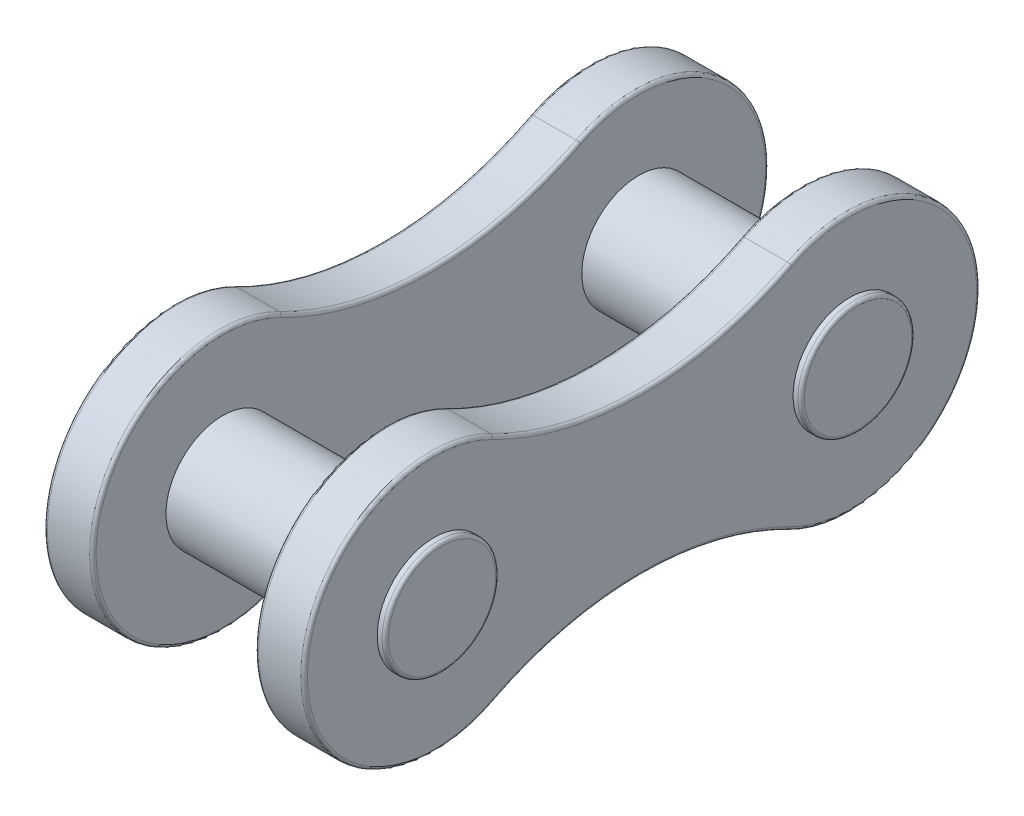
from build123d import *

# Parameters (mm, degrees)
BOSS_EXTRUDE2_START = 2.5
SKETCH5_R           = 1.75
BOSS_EXTRUDE2_DEPTH = 1.5
BOSS_EXTRUDE3_START = -2.5
SKETCH6_R           = 1.75
BOSS_EXTRUDE3_DEPTH = 1.5
SKETCH7_R           = 1.75
BOSS_EXTRUDE4_DEPTH = 4.25
FILLET1_R           = 0.1


with BuildPart() as part:
    # Sketch5 → Boss-Extrude2 (new body)
    with BuildSketch(Plane(origin=(0, 0, 0), x_dir=(0, 0, -1), z_dir=(1, 0, 0)).offset(BOSS_EXTRUDE2_START)):
        with BuildLine():
            ThreePointArc((-4.570357143, 3.557793374), (-10.3985, 0), (-4.570357143, -3.557793374))
            ThreePointArc((-4.570357143, -3.557793374), (0, -2.45227681), (4.570357143, -3.557793374))
            ThreePointArc((4.570357143, -3.557793374), (10.3985, 0), (4.570357143, 3.557793374))
            ThreePointArc((4.570357143, 3.557793374), (0, 2.45227681), (-4.570357143, 3.557793374))
        make_face()
        with Locations((-6.3985, 0)):
            Circle(SKETCH5_R, mode=Mode.SUBTRACT)
        with Locations((6.3985, 0)):
            Circle(SKETCH5_R, mode=Mode.SUBTRACT)
    extrude(amount=BOSS_EXTRUDE2_DEPTH)



with BuildPart() as body_2:
    # Sketch6 → Boss-Extrude3 (new body)
    with BuildSketch(Plane(origin=(0, 0, 0), x_dir=(0, 0, -1), z_dir=(1, 0, 0)).offset(BOSS_EXTRUDE3_START)):
        with BuildLine():
            ThreePointArc((-4.570357143, 3.557793374), (0, 2.45227681), (4.570357143, 3.557793374))
            ThreePointArc((4.570357143, 3.557793374), (10.3985, 0), (4.570357143, -3.557793374))
            ThreePointArc((4.570357143, -3.557793374), (0, -2.45227681), (-4.570357143, -3.557793374))
            ThreePointArc((-4.570357143, -3.557793374), (-10.3985, 0), (-4.570357143, 3.557793374))
        make_face()
        with Locations((6.3985, 0)):
            Circle(SKETCH6_R, mode=Mode.SUBTRACT)
        with Locations((-6.3985, 0)):
            Circle(SKETCH6_R, mode=Mode.SUBTRACT)
    extrude(amount=-BOSS_EXTRUDE3_DEPTH)


with BuildPart() as part_1:
    add(part.part)

    add(body_2.part)  # Boss-Extrude4 merges body 2
    # Sketch7 → Boss-Extrude4 (add, symmetric)
    with BuildSketch(Plane(origin=(0, 0, 0), x_dir=(0, 0, -1), z_dir=(1, 0, 0))):
        with Locations((6.3985, 0)):
            Circle(SKETCH7_R)
        with Locations((-6.3985, 0)):
            Circle(SKETCH7_R)
    extrude(amount=BOSS_EXTRUDE4_DEPTH, both=True)

    # Fillet1
    fillet1_edges = [part_1.edges().sort_by_distance(p)[0] for p in [
        (4, 0, -10.3985),
        (4, -2.45227681, 0),
        (4, 0, 10.3985),
        (2.5, 0, -10.3985),
        (2.5, -2.45227681, 0),
        (2.5, 0, 10.3985),
        (-4, 0, -10.3985),
        (-4, -2.45227681, 0),
        (-4, 0, 10.3985),
        (-2.5, 0, -10.3985),
        (-2.5, -2.45227681, 0),
        (-2.5, 0, 10.3985),
        (4, 2.45227681, 0),
        (2.5, 2.45227681, 0),
        (-4, 2.45227681, 0),
        (-2.5, 2.45227681, 0),
        (-4.25, 0, -4.6485),
        (-4.25, 0, 8.1485),
        (4.25, 0, -4.6485),
        (4.25, 0, 8.1485),
    ]]
    fillet(fillet1_edges, radius=FILLET1_R)


solid = part_1.part
